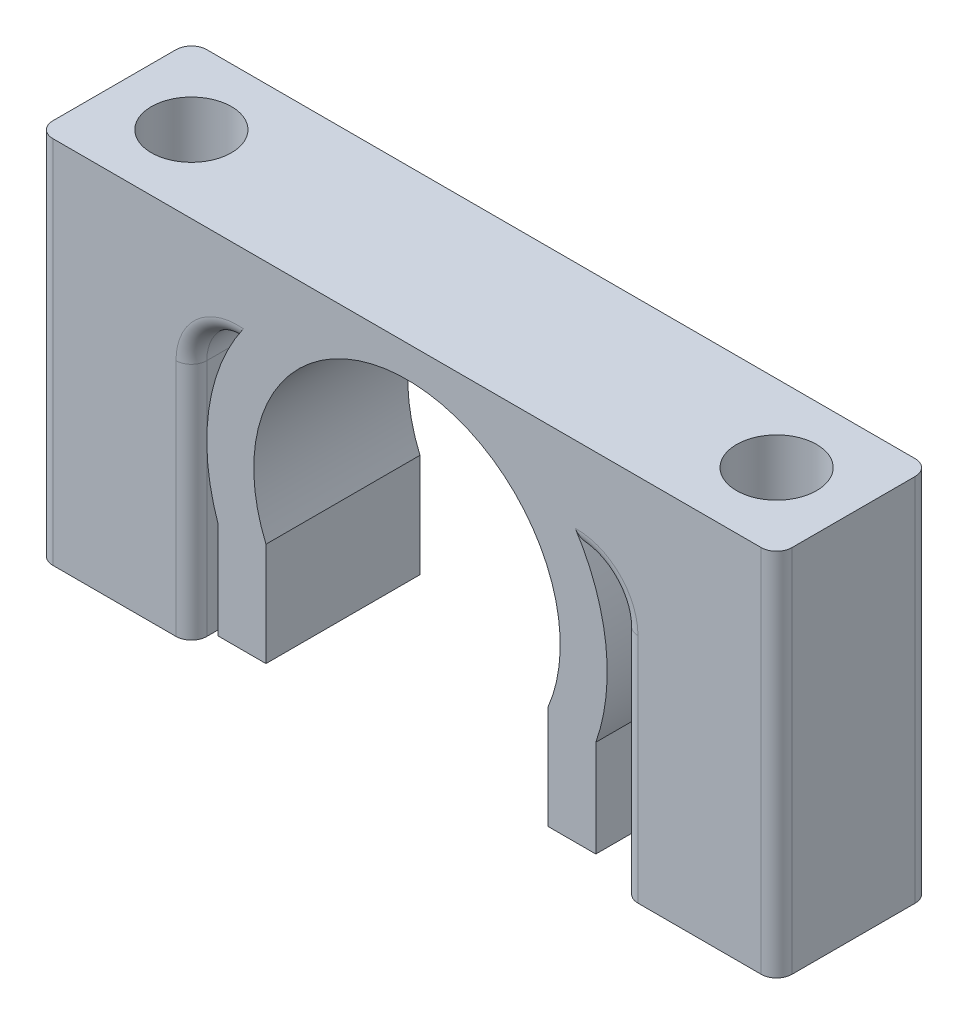
from build123d import *

# Parameters (mm, degrees)
BOSS_EXTRUDE1_DEPTH = 10
FILLET1_R           = 3
SKETCH2_R           = 2.6
CUT_EXTRUDE1_DEPTH  = 36.383612026
FILLET2_R           = 1


with BuildPart() as part:
    # Sketch1 → Boss-Extrude1 (new body)
    with BuildSketch(Plane.XY):
        with BuildLine():
            Line((-11.258330249, 6.5), (-14, 6.5))
            Line((-14, 6.5), (-14, -12))
            Line((-14, -12), (-24, -12))
            Line((-24, -12), (-24, 12))
            Line((-24, 12), (24, 12))
            Line((24, 12), (24, -12))
            Line((24, -12), (14, -12))
            Line((14, -12), (14, 6))
            Line((14, 6), (11.532562595, 6))
            ThreePointArc((11.532562595, 6), (12.967632791, 0.916787763), (12.262009764, -4.317767543))
            Line((12.262009764, -4.317767543), (12.262009764, -7.605344152))
            Line((12.262009764, -7.605344152), (12.262009764, -10.605344152))
            Line((12.262009764, -10.605344152), (9.157960199, -10.605344152))
            Line((9.157960199, -10.605344152), (9.157960199, -3.890278267))
            ThreePointArc((9.157960199, -3.890278267), (0, 9.95), (-9.157960199, -3.890278267))
            Line((-9.157960199, -3.890278267), (-9.157960199, -10.605344152))
            Line((-9.157960199, -10.605344152), (-12.262862833, -10.605344152))
            Line((-12.262862833, -10.605344152), (-12.262862833, -7.605344152))
            Line((-12.262862833, -7.605344152), (-12.262862833, -4.315344152))
            ThreePointArc((-12.262862833, -4.315344152), (-12.944286318, 1.202269405), (-11.258330249, 6.5))
        make_face()
    extrude(amount=BOSS_EXTRUDE1_DEPTH)

    # Fillet1
    # the kernel refuses this fillet: 3 mm, written as the material it adds along each edge
    with BuildSketch(Plane(origin=(14, 6, 0), x_dir=(-1, 0, 0), z_dir=(0, 0, 1))) as fillet1_piece_1:
        with BuildLine():
            CenterArc((3, 2.952351111), FILLET1_R, 180, 79.774609626)
            Line((0, 2.952351111), (-0.06, 2.952351111))
            Line((-0.06, 2.952351111), (-0.06, 0))
            Line((-0.06, 0), (0, -0.06))
            ThreePointArc((0, -0.06), (1.233718703, -0.06), (2.456786153, -0.059047022))
            Line((2.456786153, -0.059047022), (2.467437405, 0))
        make_face()
    extrude(amount=10)
    with BuildSketch(Plane(origin=(-14, 6.5, 0), x_dir=(1, 0, 0), z_dir=(0, 0, 1))) as fillet1_piece_2:
        with BuildLine():
            CenterArc((3, -2.988856886), FILLET1_R, 94.93986201, 85.06013799)
            Line((0, -2.988856886), (-0.06, -2.988856886))
            Line((-0.06, -2.988856886), (-0.06, 0))
            Line((-0.06, 0), (0, 0.06))
            ThreePointArc((0, 0.06), (1.370834875, 0.06), (2.736503146, 0.059777138))
            Line((2.736503146, 0.059777138), (2.741669751, 0))
        make_face()
    extrude(amount=10)

    # Sketch2 → Cut-Extrude1 (cut, through all)
    with BuildSketch(Plane.XZ.offset(12)):
        with Locations(Location((-19, 5, 0), (0, 0, 270))):
            Circle(SKETCH2_R)
        with Locations(Location((19, 5, 0), (0, 0, 270))):
            Circle(SKETCH2_R)
    extrude(amount=-CUT_EXTRUDE1_DEPTH, mode=Mode.SUBTRACT)

    # Fillet2
    # the kernel refuses this fillet: 1 mm, written as the material it takes off along each edge
    with BuildSketch(Plane(origin=(-24, -14.5, 0), x_dir=(1, 0, 0), z_dir=(0, 1, 0)), Plane(origin=(24, 14.5, 0), x_dir=(-1, 0, 0), z_dir=(0, -1, 0))) as fillet2_piece_1:
        with BuildLine():
            CenterArc((FILLET2_R, -FILLET2_R), FILLET2_R, 90, 90)
            Line((0, -FILLET2_R), (0, 0))
            Line((0, 0), (FILLET2_R, 0))
        make_face()
    extrude(amount=29, mode=Mode.SUBTRACT)
    with BuildSketch(Plane(origin=(14, -14.5, 0), x_dir=(1, 0, 0), z_dir=(0, 1, 0))) as fillet2_piece_2:
        with BuildLine():
            CenterArc((FILLET2_R, -FILLET2_R), FILLET2_R, 90, 90)
            Line((0, -FILLET2_R), (0, 0))
            Line((0, 0), (FILLET2_R, 0))
        make_face()
    extrude(amount=17.547648889, mode=Mode.SUBTRACT)
    with BuildSketch(Plane(origin=(14, -14.5, 10), x_dir=(1, 0, 0), z_dir=(0, 1, 0))) as fillet2_piece_3:
        with BuildLine():
            CenterArc((FILLET2_R, FILLET2_R), FILLET2_R, 180, 90)
            Line((0, FILLET2_R), (0, 0))
            Line((0, 0), (FILLET2_R, 0))
        make_face()
    extrude(amount=17.547648889, mode=Mode.SUBTRACT)
    with BuildSketch(Plane(origin=(-14, 3.511143114, 0), x_dir=(0, 0, 1), z_dir=(0, -1, 0))) as fillet2_piece_4:
        with BuildLine():
            CenterArc((FILLET2_R, FILLET2_R), FILLET2_R, 180, 90)
            Line((0, FILLET2_R), (0, 0))
            Line((0, 0), (FILLET2_R, 0))
        make_face()
    extrude(amount=18.011143114, mode=Mode.SUBTRACT)
    with BuildSketch(Plane(origin=(-14, 3.511143114, 10), x_dir=(0, 0, -1), z_dir=(0, -1, 0))) as fillet2_piece_5:
        with BuildLine():
            CenterArc((FILLET2_R, -FILLET2_R), FILLET2_R, 90, 90)
            Line((0, -FILLET2_R), (0, 0))
            Line((0, 0), (FILLET2_R, 0))
        make_face()
    extrude(amount=18.011143114, mode=Mode.SUBTRACT)
    with BuildSketch(Plane(origin=(11, 3.047648889, 0), x_dir=(1, 0, 0), z_dir=(0, -1, 0))) as fillet2_piece_6_section:
        with BuildLine():
            CenterArc((3 + FILLET2_R, FILLET2_R), FILLET2_R, 180, 90)
            Line((3, FILLET2_R), (3, 0))
            Line((3, 0), (3 + FILLET2_R, 0))
        make_face()
    fillet2_piece_6 = revolve(axis=Axis((11, 3.047648889, 0), (0, 0, 1)), revolution_arc=127.536161061, mode=Mode.PRIVATE)
    fillet2_piece_6 = fillet2_piece_6 - Plane(origin=(0, 0, 0.285399127), x_dir=(0.8871201995900612, 0.46153846153846184, 0), z_dir=(0, 0, -1)) * Cylinder(13, 16, mode=Mode.PRIVATE)
    add(fillet2_piece_6, mode=Mode.SUBTRACT)
    with BuildSketch(Plane(origin=(11, 3.047648889, 10), x_dir=(1, 0, 0), z_dir=(0, -1, 0))) as fillet2_piece_7_section:
        with BuildLine():
            CenterArc((3 + FILLET2_R, -FILLET2_R), FILLET2_R, 90, 90)
            Line((3, -FILLET2_R), (3, 0))
            Line((3, 0), (3 + FILLET2_R, 0))
        make_face()
    fillet2_piece_7 = revolve(axis=Axis((11, 3.047648889, 10), (0, 0, 1)), revolution_arc=127.536161061, mode=Mode.PRIVATE)
    fillet2_piece_7 = fillet2_piece_7 - Plane(origin=(0, 0, 9.714600873), x_dir=(0.8871201995900612, 0.46153846153846184, 0), z_dir=(0, 0, -1)) * Cylinder(13, 16, mode=Mode.PRIVATE)
    add(fillet2_piece_7, mode=Mode.SUBTRACT)
    with BuildSketch(Plane(origin=(-11, 3.511143114, 0), x_dir=(0.6797454248064234, 0.7334481286735518, 0), z_dir=(0.7334481286735518, -0.6797454248064234, 0))) as fillet2_piece_8_section:
        with BuildLine():
            CenterArc((3 + FILLET2_R, FILLET2_R), FILLET2_R, 180, 90)
            Line((3 + FILLET2_R, 0), (3, 0))
            Line((3, 0), (3, FILLET2_R))
        make_face()
    fillet2_piece_8 = revolve(axis=Axis((-11, 3.511143114, 0), (0, 0, 1)), revolution_arc=132.823752842, mode=Mode.PRIVATE)
    fillet2_piece_8 = fillet2_piece_8 - Plane(origin=(0, 0, 0.285251349), x_dir=(-0.9432971409738413, -0.3319495501285957, 0), z_dir=(0, 0, -1)) * Cylinder(13, 17, mode=Mode.PRIVATE)
    add(fillet2_piece_8, mode=Mode.SUBTRACT)
    with BuildSketch(Plane(origin=(-11, 3.511143114, 10), x_dir=(0.6797454248064234, 0.7334481286735518, 0), z_dir=(0.7334481286735518, -0.6797454248064234, 0))) as fillet2_piece_9_section:
        with BuildLine():
            CenterArc((3 + FILLET2_R, -FILLET2_R), FILLET2_R, 90, 90)
            Line((3 + FILLET2_R, 0), (3, 0))
            Line((3, 0), (3, -FILLET2_R))
        make_face()
    fillet2_piece_9 = revolve(axis=Axis((-11, 3.511143114, 10), (0, 0, 1)), revolution_arc=132.823752842, mode=Mode.PRIVATE)
    fillet2_piece_9 = fillet2_piece_9 - Plane(origin=(0, 0, 9.714748651), x_dir=(-0.9432971409738413, -0.3319495501285957, 0), z_dir=(0, 0, -1)) * Cylinder(13, 17, mode=Mode.PRIVATE)
    add(fillet2_piece_9, mode=Mode.SUBTRACT)
    with BuildSketch(Plane(origin=(24, 14.5, 10), x_dir=(-1, 0, 0), z_dir=(0, -1, 0)), Plane(origin=(-24, -14.5, 10), x_dir=(1, 0, 0), z_dir=(0, 1, 0))) as fillet2_piece_10:
        with BuildLine():
            CenterArc((FILLET2_R, FILLET2_R), FILLET2_R, 180, 90)
            Line((0, FILLET2_R), (0, 0))
            Line((0, 0), (FILLET2_R, 0))
        make_face()
    extrude(amount=29, mode=Mode.SUBTRACT)


solid = part.part
